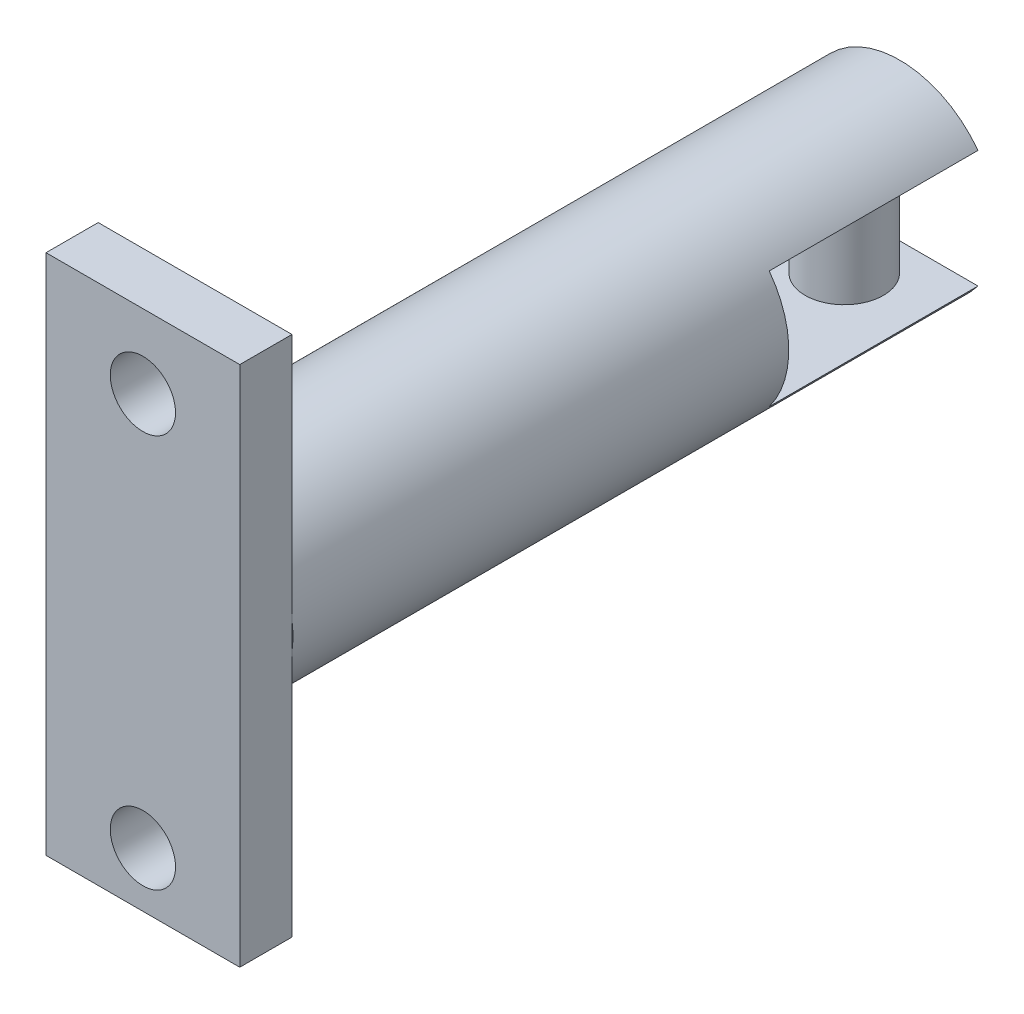
from build123d import *

# Parameters (mm, degrees)
SKETCH1_R           = 7.5
BOSS_EXTRUDE1_DEPTH = 54
SKETCH2_W           = 16.302555912
SKETCH2_H           = 9
CUT_EXTRUDE1_DEPTH  = 16
SKETCH3_R           = 3
BOSS_EXTRUDE3_DEPTH = 11
SKETCH4_W           = 14.849973222
SKETCH4_H           = 40
SKETCH4_R           = 2.5
BOSS_EXTRUDE4_DEPTH = 4


with BuildPart() as part:
    # Sketch1 → Boss-Extrude1 (new body)
    with BuildSketch(Plane.XY):
        Circle(SKETCH1_R)
    extrude(amount=BOSS_EXTRUDE1_DEPTH)

    # Sketch2 → Cut-Extrude1 (cut)
    with BuildSketch(Plane.XY):
        Rectangle(SKETCH2_W, SKETCH2_H)
    extrude(amount=CUT_EXTRUDE1_DEPTH, mode=Mode.SUBTRACT)

    # Sketch3 → Boss-Extrude3 (add)
    with BuildSketch(Plane(origin=(0, 4.5, 0), x_dir=(-1, 0, 0), z_dir=(0, -1, 0))):
        with Locations((0, -4.24806539)):
            Circle(SKETCH3_R)
    extrude(amount=BOSS_EXTRUDE3_DEPTH)

    # Sketch4 → Boss-Extrude4 (add)
    with BuildSketch(Plane.XY.offset(54)):
        Rectangle(SKETCH4_W, SKETCH4_H)
        with Locations((0, -15.803277386)):
            Circle(SKETCH4_R, mode=Mode.SUBTRACT)
        with Locations((0, 14.342093526)):
            Circle(SKETCH4_R, mode=Mode.SUBTRACT)
    extrude(amount=BOSS_EXTRUDE4_DEPTH)


solid = part.part
